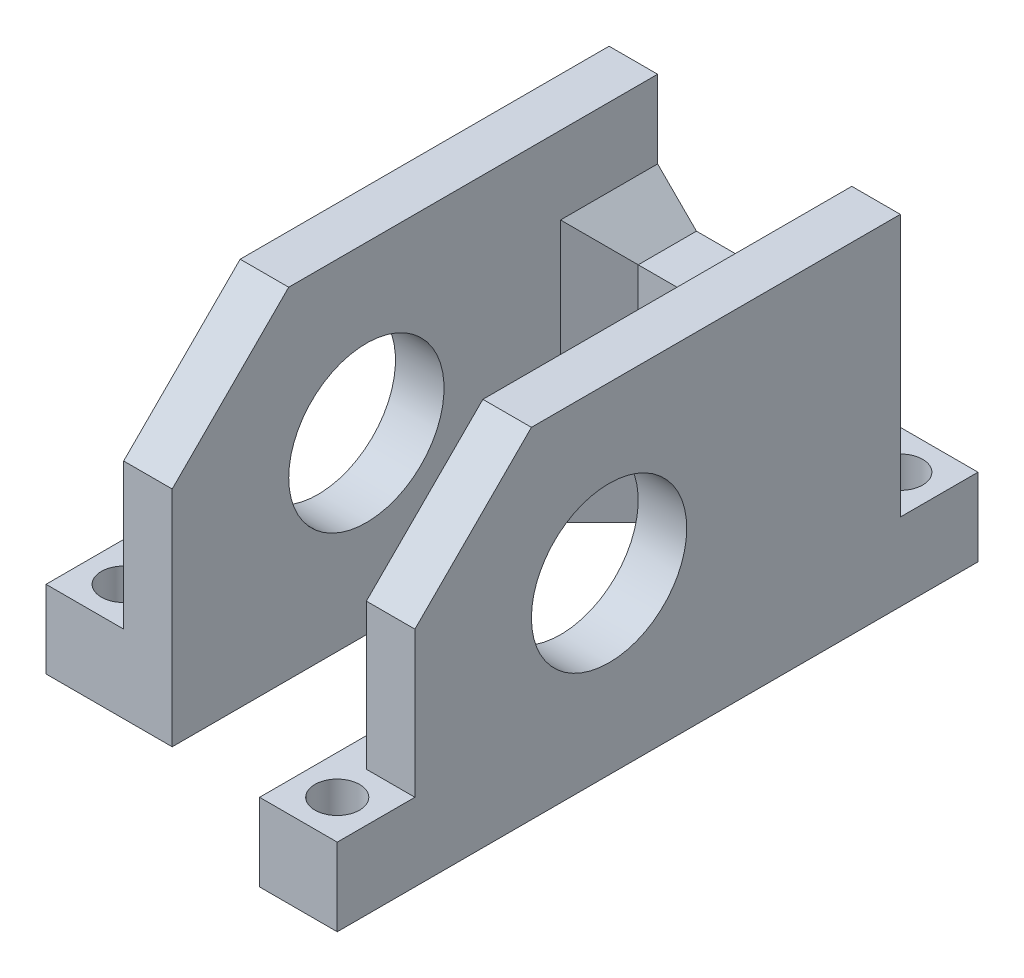
from build123d import *

# Parameters (mm, degrees)
BOSS_EXTRU_1_DEPTH      = 35
BOSS_EXTRU_7_DEPTH      = 8
ESQUISSE1_8_W           = 8
ESQUISSE1_8_H           = 8
ESQUISSE1_8_R           = 2.3
BOSS_EXTRU_8_DEPTH      = 8
BOSS_EXTRU_9_DEPTH      = 35
ENL_V_MAT_EXTRU_5_DEPTH = 35
ESQUISSE8_R             = 8
ENL_V_MAT_EXTRU_6_DEPTH = 50


with BuildPart() as part:
    # Esquisse1 → Boss.-Extru.1 (new body)
    with BuildSketch(Plane(origin=(0, 0, 0), x_dir=(1, 0, 0), z_dir=(0, 1, 0))):
        Polygon((-18, 9), (-23, 9), (-23, 3), (-23, 1), (-23, -33), (-23, -41), (-18, -41), (-18, 3), (2, 3), (2, -37), (2, -41), (7, -41), (7, 3), (7, 9), (2, 9), (-1, 9), align=None)
    extrude(amount=BOSS_EXTRU_1_DEPTH)

    # Esquisse1<6> → Boss.-Extru.7 (add)
    with BuildSketch(Plane(origin=(0, 0, 0), x_dir=(1, 0, 0), z_dir=(0, 1, 0))):
        Polygon((-18, 9), (-23, 9), (-23, 3), (-23, 1), (-23, -33), (-23, -41), (-18, -41), (-18, 3), (2, 3), (2, -37), (2, -41), (7, -41), (7, 3), (7, 9), (2, 9), (-1, 9), align=None)
    extrude(amount=BOSS_EXTRU_7_DEPTH)

    # Esquisse1<8> → Boss.-Extru.8 (add)
    # profile 1 of 4: a face of its own
    with BuildSketch(Plane(origin=(0, 0, 0), x_dir=(1, 0, 0), z_dir=(0, 1, 0))):
        with Locations((-27, 5)):
            Rectangle(ESQUISSE1_8_W, ESQUISSE1_8_H)
        with Locations((-27, 5)):
            Circle(ESQUISSE1_8_R, mode=Mode.SUBTRACT)
    # profile 2 of 4: a face of its own
    with BuildSketch(Plane(origin=(0, 0, 0), x_dir=(1, 0, 0), z_dir=(0, 1, 0))):
        with Locations((3, 13)):
            Rectangle(ESQUISSE1_8_W, ESQUISSE1_8_H)
        with Locations((3, 13)):
            Circle(ESQUISSE1_8_R, mode=Mode.SUBTRACT)
    # profile 3 of 4: a face of its own
    with BuildSketch(Plane(origin=(0, 0, 0), x_dir=(1, 0, 0), z_dir=(0, 1, 0))):
        with Locations((-27, -37)):
            Rectangle(ESQUISSE1_8_W, ESQUISSE1_8_H)
        with Locations((-27, -37)):
            Circle(ESQUISSE1_8_R, mode=Mode.SUBTRACT)
    # profile 4 of 4: a face of its own
    with BuildSketch(Plane(origin=(0, 0, 0), x_dir=(1, 0, 0), z_dir=(0, 1, 0))):
        Polygon((7, -49), (7, -41), (2, -41), (2, -37), (-1, -37), (-1, -49), align=None)
        with Locations((3, -45)):
            Circle(ESQUISSE1_8_R, mode=Mode.SUBTRACT)
    extrude(amount=BOSS_EXTRU_8_DEPTH)

    # Esquisse6 → Boss.-Extru.9 (add)
    with BuildSketch(Plane.XZ):
        Polygon((-18, -3), (-14, -3), (-18, 1), align=None)
        Polygon((2, -3), (-2, -3), (2, 1), align=None)
    extrude(amount=-BOSS_EXTRU_9_DEPTH)

    # Esquisse7 → Enlèv. mat.-Extru.5 (cut)
    with BuildSketch(Plane(origin=(0, 0, -9), x_dir=(-1, 0, 0), z_dir=(0, 0, -1))):
        Polygon((18, 35), (-2, 35), (-2, 27), (2, 23), (14, 23), (18, 27), align=None)
    extrude(amount=-ENL_V_MAT_EXTRU_5_DEPTH, mode=Mode.SUBTRACT)

    # Esquisse8 → Enlèv. mat.-Extru.6 (cut)
    with BuildSketch(Plane.ZY.offset(23)):
        Polygon((41, 23), (41, 35), (29, 35), align=None)
        with Locations((21, 18)):
            Circle(ESQUISSE8_R)
    extrude(amount=-ENL_V_MAT_EXTRU_6_DEPTH, mode=Mode.SUBTRACT)


solid = part.part
